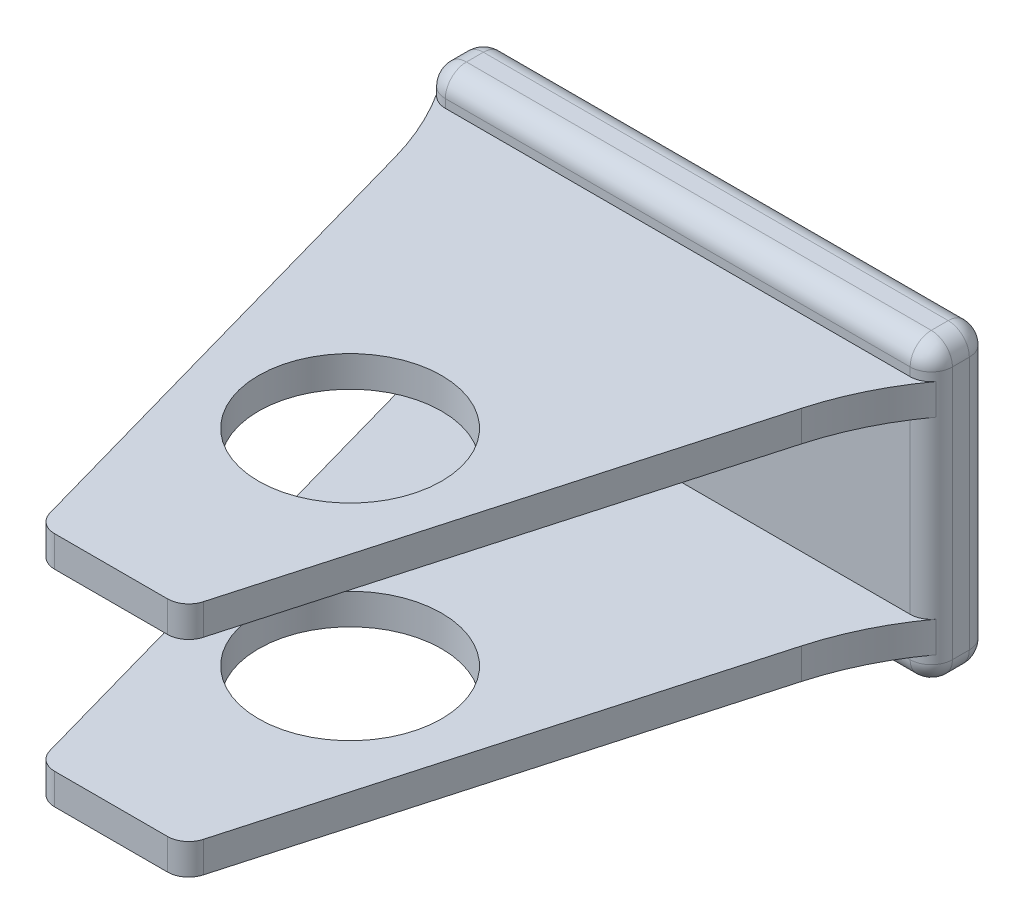
from build123d import *

# Parameters (mm, degrees)
SKETCH1_W           = 120
SKETCH1_H           = 70
SKETCH1_R           = 13.333333333
BOSS_EXTRUDE1_DEPTH = 14
BOSS_EXTRUDE2_DEPTH = 7.3
SKETCH4_R           = 21.666666667
CUT_EXTRUDE1_DEPTH  = 172.159351628
FILLET1_R           = 5
FILLET2_R           = 5
SCALE1_SCALE        = 0.15
FILLET3_START       = -4.2
FILLET3_DEPTH       = 1.095
FILLET3_START_2     = 3.105
FILLET3_2_DEPTH     = 1.095


with BuildPart() as part:
    # Sketch1 → Boss-Extrude1 (new body)
    with BuildSketch(Plane.XY):
        Rectangle(SKETCH1_W, SKETCH1_H)
        Circle(SKETCH1_R, mode=Mode.SUBTRACT)
    extrude(amount=BOSS_EXTRUDE1_DEPTH)

    # Sketch3 → Boss-Extrude2 (add)
    with BuildSketch(Plane(origin=(0, -28, 0), x_dir=(-1, 0, 0), z_dir=(0, -1, 0))):
        Polygon((55.436544165, -14), (-54.063561803, -14), (-16.446396869, -147.399198267), (17.819379231, -147.399198267), align=None)
    boss_extrude2 = extrude(amount=-BOSS_EXTRUDE2_DEPTH)

    # Mirror1: Boss-Extrude2 across plane
    add(boss_extrude2.mirror(Plane.ZX))

    # Sketch4 → Cut-Extrude1 (cut, through all)
    with BuildSketch(Plane.XZ.offset(28)):
        with Locations(Location((-0.686491181, 90.853024988, 0), (0, 0, 90))):
            Circle(SKETCH4_R)
    extrude(amount=-CUT_EXTRUDE1_DEPTH, mode=Mode.SUBTRACT)

    # Fillet1
    # the kernel refuses this fillet: 5 mm, written as the material it takes off along each edge
    with BuildSketch(Plane(origin=(-55, 30, 9), x_dir=(0, 0, 1), z_dir=(-1, 0, 0))) as fillet1_piece_1_section:
        Polygon((0, 0), (FILLET1_R * 1.02, 0), (FILLET1_R * 1.02, FILLET1_R * 1.02), (0, FILLET1_R * 1.02), align=None)
    fillet1_piece_1 = extrude(amount=FILLET1_R * 1.02, mode=Mode.PRIVATE)
    fillet1_piece_1 = fillet1_piece_1 - Plane(origin=(-55, 30, 9), x_dir=(0, -0.7071067811865475, -0.7071067811865475), z_dir=(-1, 0, 0)) * Sphere(FILLET1_R, mode=Mode.PRIVATE)
    add(fillet1_piece_1, mode=Mode.SUBTRACT)
    with BuildSketch(Plane(origin=(-55, -30, 9), x_dir=(-1, 0, 0), z_dir=(0, -1, 0))) as fillet1_piece_2_section:
        Polygon((0, 0), (FILLET1_R * 1.02, 0), (FILLET1_R * 1.02, -FILLET1_R * 1.02), (0, -FILLET1_R * 1.02), align=None)
    fillet1_piece_2 = extrude(amount=FILLET1_R * 1.02, mode=Mode.PRIVATE)
    fillet1_piece_2 = fillet1_piece_2 - Plane(origin=(-55, -30, 9), x_dir=(0.7071067811865475, 0, -0.7071067811865475), z_dir=(0, -1, 0)) * Sphere(FILLET1_R, mode=Mode.PRIVATE)
    add(fillet1_piece_2, mode=Mode.SUBTRACT)
    with BuildSketch(Plane(origin=(-55, 30, 5), x_dir=(0, 0, -1), z_dir=(-1, 0, 0))) as fillet1_piece_3_section:
        Polygon((0, 0), (FILLET1_R * 1.02, 0), (FILLET1_R * 1.02, -FILLET1_R * 1.02), (0, -FILLET1_R * 1.02), align=None)
    fillet1_piece_3 = extrude(amount=FILLET1_R * 1.02, mode=Mode.PRIVATE)
    fillet1_piece_3 = fillet1_piece_3 - Plane(origin=(-55, 30, 5), x_dir=(0, -0.7071067811865475, 0.7071067811865475), z_dir=(-1, 0, 0)) * Sphere(FILLET1_R, mode=Mode.PRIVATE)
    add(fillet1_piece_3, mode=Mode.SUBTRACT)
    with BuildSketch(Plane(origin=(-55, -30, 5), x_dir=(-1, 0, 0), z_dir=(0, -1, 0))) as fillet1_piece_4_section:
        Polygon((0, 0), (FILLET1_R * 1.02, 0), (FILLET1_R * 1.02, FILLET1_R * 1.02), (0, FILLET1_R * 1.02), align=None)
    fillet1_piece_4 = extrude(amount=FILLET1_R * 1.02, mode=Mode.PRIVATE)
    fillet1_piece_4 = fillet1_piece_4 - Plane(origin=(-55, -30, 5), x_dir=(0.7071067811865475, 0, 0.7071067811865475), z_dir=(0, -1, 0)) * Sphere(FILLET1_R, mode=Mode.PRIVATE)
    add(fillet1_piece_4, mode=Mode.SUBTRACT)
    with BuildSketch(Plane(origin=(55, 30, 9), x_dir=(0, 0, 1), z_dir=(1, 0, 0))) as fillet1_piece_5_section:
        Polygon((0, 0), (FILLET1_R * 1.02, 0), (FILLET1_R * 1.02, -FILLET1_R * 1.02), (0, -FILLET1_R * 1.02), align=None)
    fillet1_piece_5 = extrude(amount=FILLET1_R * 1.02, mode=Mode.PRIVATE)
    fillet1_piece_5 = fillet1_piece_5 - Plane(origin=(55, 30, 9), x_dir=(0, -0.7071067811865475, -0.7071067811865475), z_dir=(1, 0, 0)) * Sphere(FILLET1_R, mode=Mode.PRIVATE)
    add(fillet1_piece_5, mode=Mode.SUBTRACT)
    with BuildSketch(Plane(origin=(55, 30, 5), x_dir=(0, 0, -1), z_dir=(1, 0, 0))) as fillet1_piece_6_section:
        Polygon((0, 0), (FILLET1_R * 1.02, 0), (FILLET1_R * 1.02, FILLET1_R * 1.02), (0, FILLET1_R * 1.02), align=None)
    fillet1_piece_6 = extrude(amount=FILLET1_R * 1.02, mode=Mode.PRIVATE)
    fillet1_piece_6 = fillet1_piece_6 - Plane(origin=(55, 30, 5), x_dir=(0, -0.7071067811865475, 0.7071067811865475), z_dir=(1, 0, 0)) * Sphere(FILLET1_R, mode=Mode.PRIVATE)
    add(fillet1_piece_6, mode=Mode.SUBTRACT)
    with BuildSketch(Plane(origin=(55, -30, 9), x_dir=(1, 0, 0), z_dir=(0, -1, 0))) as fillet1_piece_7_section:
        Polygon((0, 0), (FILLET1_R * 1.02, 0), (FILLET1_R * 1.02, FILLET1_R * 1.02), (0, FILLET1_R * 1.02), align=None)
    fillet1_piece_7 = extrude(amount=FILLET1_R * 1.02, mode=Mode.PRIVATE)
    fillet1_piece_7 = fillet1_piece_7 - Plane(origin=(55, -30, 9), x_dir=(-0.7071067811865475, 0, -0.7071067811865475), z_dir=(0, -1, 0)) * Sphere(FILLET1_R, mode=Mode.PRIVATE)
    add(fillet1_piece_7, mode=Mode.SUBTRACT)
    with BuildSketch(Plane(origin=(55, -30, 5), x_dir=(1, 0, 0), z_dir=(0, -1, 0))) as fillet1_piece_8_section:
        Polygon((0, 0), (FILLET1_R * 1.02, 0), (FILLET1_R * 1.02, -FILLET1_R * 1.02), (0, -FILLET1_R * 1.02), align=None)
    fillet1_piece_8 = extrude(amount=FILLET1_R * 1.02, mode=Mode.PRIVATE)
    fillet1_piece_8 = fillet1_piece_8 - Plane(origin=(55, -30, 5), x_dir=(-0.7071067811865475, 0, 0.7071067811865475), z_dir=(0, -1, 0)) * Sphere(FILLET1_R, mode=Mode.PRIVATE)
    add(fillet1_piece_8, mode=Mode.SUBTRACT)
    with BuildSketch(Plane(origin=(-60, 30, 14), x_dir=(0, 0, -1), z_dir=(0, -1, 0))) as fillet1_piece_9_section:
        with BuildLine():
            CenterArc((FILLET1_R, FILLET1_R), FILLET1_R, 180, 90)
            Line((0, FILLET1_R), (0, 0))
            Line((0, 0), (FILLET1_R, 0))
        make_face()
    fillet1_piece_9 = extrude(amount=60, mode=Mode.PRIVATE)
    fillet1_piece_9 = split(fillet1_piece_9, bisect_by=Plane(origin=(-55.772691467, 30, 12.807943643), z_dir=(-0.9624652257513497, 0, 0.2714050279921198)), keep=Keep.TOP, mode=Mode.PRIVATE)
    add(fillet1_piece_9, mode=Mode.SUBTRACT)
    with BuildSketch(Plane(origin=(-60, 30, 14), x_dir=(0, 0, -1), z_dir=(0, -1, 0))) as fillet1_piece_10_section:
        with BuildLine():
            CenterArc((FILLET1_R, FILLET1_R), FILLET1_R, 180, 90)
            Line((0, FILLET1_R), (0, 0))
            Line((0, 0), (FILLET1_R, 0))
        make_face()
    fillet1_piece_10 = extrude(amount=60, mode=Mode.PRIVATE)
    fillet1_piece_10 = split(fillet1_piece_10, bisect_by=Plane(origin=(-60, 28, 14), z_dir=(0, 1, 0)), keep=Keep.TOP, mode=Mode.PRIVATE)
    add(fillet1_piece_10, mode=Mode.SUBTRACT)
    with BuildSketch(Plane(origin=(-60, 30, 14), x_dir=(0, 0, -1), z_dir=(0, -1, 0))) as fillet1_piece_11_section:
        with BuildLine():
            CenterArc((FILLET1_R, FILLET1_R), FILLET1_R, 180, 90)
            Line((0, FILLET1_R), (0, 0))
            Line((0, 0), (FILLET1_R, 0))
        make_face()
    fillet1_piece_11 = extrude(amount=60, mode=Mode.PRIVATE)
    fillet1_piece_11 = split(fillet1_piece_11, bisect_by=Plane(origin=(-60, -20.7, 14), z_dir=(0, 1, 0)), keep=Keep.TOP, mode=Mode.PRIVATE)
    fillet1_piece_11 = split(fillet1_piece_11, bisect_by=Plane(origin=(-60, 20.7, 14), z_dir=(0, -1, 0)), keep=Keep.TOP, mode=Mode.PRIVATE)
    add(fillet1_piece_11, mode=Mode.SUBTRACT)
    with BuildSketch(Plane(origin=(-60, 30, 14), x_dir=(0, 0, -1), z_dir=(0, -1, 0))) as fillet1_piece_12_section:
        with BuildLine():
            CenterArc((FILLET1_R, FILLET1_R), FILLET1_R, 180, 90)
            Line((0, FILLET1_R), (0, 0))
            Line((0, 0), (FILLET1_R, 0))
        make_face()
    fillet1_piece_12 = extrude(amount=60, mode=Mode.PRIVATE)
    fillet1_piece_12 = split(fillet1_piece_12, bisect_by=Plane(origin=(-60, -28, 14), z_dir=(0, -1, 0)), keep=Keep.TOP, mode=Mode.PRIVATE)
    add(fillet1_piece_12, mode=Mode.SUBTRACT)
    with BuildSketch(Plane(origin=(-60, 30, 0), x_dir=(0, 0, 1), z_dir=(0, -1, 0)), Plane(origin=(60, -30, 0), x_dir=(0, 0, 1), z_dir=(0, 1, 0))) as fillet1_piece_13:
        with BuildLine():
            CenterArc((FILLET1_R, -FILLET1_R), FILLET1_R, 90, 90)
            Line((0, -FILLET1_R), (0, 0))
            Line((0, 0), (FILLET1_R, 0))
        make_face()
    extrude(amount=60, mode=Mode.SUBTRACT)
    with BuildSketch(Plane(origin=(55, 35, 14), x_dir=(0, -1, 0), z_dir=(-1, 0, 0)), Plane(origin=(-55, -35, 0), x_dir=(0, 0, 1), z_dir=(1, 0, 0))) as fillet1_piece_14:
        with BuildLine():
            CenterArc((FILLET1_R, -FILLET1_R), FILLET1_R, 90, 90)
            Line((0, -FILLET1_R), (0, 0))
            Line((0, 0), (FILLET1_R, 0))
        make_face()
    extrude(amount=110, mode=Mode.SUBTRACT)
    with BuildSketch(Plane(origin=(-60, 35, 5), x_dir=(0, -1, 0), z_dir=(0, 0, 1)), Plane(origin=(-60, -35, 5), x_dir=(1, 0, 0), z_dir=(0, 0, 1))) as fillet1_piece_15:
        with BuildLine():
            CenterArc((FILLET1_R, FILLET1_R), FILLET1_R, 180, 90)
            Line((0, FILLET1_R), (0, 0))
            Line((0, 0), (FILLET1_R, 0))
        make_face()
    extrude(amount=4, mode=Mode.SUBTRACT)
    with BuildSketch(Plane(origin=(55, 35, 0), x_dir=(0, -1, 0), z_dir=(-1, 0, 0)), Plane(origin=(-55, -35, 14), x_dir=(0, 0, -1), z_dir=(1, 0, 0))) as fillet1_piece_16:
        with BuildLine():
            CenterArc((FILLET1_R, FILLET1_R), FILLET1_R, 180, 90)
            Line((0, FILLET1_R), (0, 0))
            Line((0, 0), (FILLET1_R, 0))
        make_face()
    extrude(amount=110, mode=Mode.SUBTRACT)
    with BuildSketch(Plane(origin=(60, -30, 14), x_dir=(0, 0, -1), z_dir=(0, 1, 0))) as fillet1_piece_17:
        with BuildLine():
            CenterArc((FILLET1_R, FILLET1_R), FILLET1_R, 180, 90)
            Line((0, FILLET1_R), (0, 0))
            Line((0, 0), (FILLET1_R, 0))
        make_face()
    extrude(amount=60, mode=Mode.SUBTRACT)
    with BuildSketch(Plane(origin=(60, 35, 5), x_dir=(0, -1, 0), z_dir=(0, 0, 1)), Plane(origin=(60, -35, 5), x_dir=(-1, 0, 0), z_dir=(0, 0, 1))) as fillet1_piece_18:
        with BuildLine():
            CenterArc((FILLET1_R, -FILLET1_R), FILLET1_R, 90, 90)
            Line((0, -FILLET1_R), (0, 0))
            Line((0, 0), (FILLET1_R, 0))
        make_face()
    extrude(amount=4, mode=Mode.SUBTRACT)

    # Fillet2
    fillet2_edges = [part.edges().sort_by_distance(p)[0] for p in [
        (-17.819379231, -24.35, 147.399198267),
        (16.446396869, -24.35, 147.399198267),
        (16.446396869, 24.35, 147.399198267),
        (-17.819379231, 24.35, 147.399198267),
    ]]
    fillet(fillet2_edges, radius=FILLET2_R)


with BuildPart() as part_1:
    # Scale1: scaled about (-0.362902499, 0, 37.686238577)
    add(part.part.scale(SCALE1_SCALE).moved(Location((-0.308467124, 0, 32.03330279))))

    # Fillet3: read off the stored shape, not the designer's step
    # Fillet3 outline → Fillet3 (add)
    with BuildSketch(Plane(origin=(0, 0, 0), x_dir=(1, 0, 0), z_dir=(0, 1, 0)).offset(FILLET3_START)):
        with BuildLine():
            ThreePointArc((-8.624776975, -34.130365708), (-8.945174574, -34.025920365), (-9.187499582, -33.791736588))
            ThreePointArc((-9.187499582, -33.791736588), (-8.465735644, -35.11094716), (-7.949946764, -36.523470273))
            Line((-7.949946764, -36.523470273), (-8.624776975, -34.130365708))
        make_face()
        with BuildLine():
            Line((7.941532876, -34.13330279), (7.801067146, -34.13330279))
            Line((7.801067146, -34.13330279), (6.984932745, -37.027504812))
            ThreePointArc((6.984932745, -37.027504812), (7.621987061, -35.357141421), (8.546280698, -33.826901788))
            ThreePointArc((8.546280698, -33.826901788), (8.280502455, -34.052331656), (7.941532876, -34.13330279))
        make_face()
    extrude(amount=FILLET3_DEPTH)

    # Fillet3 2 outline → Fillet3 2 (add)
    with BuildSketch(Plane(origin=(0, 0, 0), x_dir=(1, 0, 0), z_dir=(0, 1, 0)).offset(FILLET3_START_2)):
        with BuildLine():
            ThreePointArc((-8.624776975, -34.130365708), (-8.945174574, -34.025920365), (-9.187499582, -33.791736588))
            ThreePointArc((-9.187499582, -33.791736588), (-8.465735644, -35.11094716), (-7.949946764, -36.523470273))
            Line((-7.949946764, -36.523470273), (-8.624776975, -34.130365708))
        make_face()
        with BuildLine():
            Line((7.941532876, -34.13330279), (7.801067146, -34.13330279))
            Line((7.801067146, -34.13330279), (6.984932745, -37.027504812))
            ThreePointArc((6.984932745, -37.027504812), (7.621987061, -35.357141421), (8.546280698, -33.826901788))
            ThreePointArc((8.546280698, -33.826901788), (8.280502455, -34.052331656), (7.941532876, -34.13330279))
        make_face()
    extrude(amount=FILLET3_2_DEPTH)


solid = part_1.part
